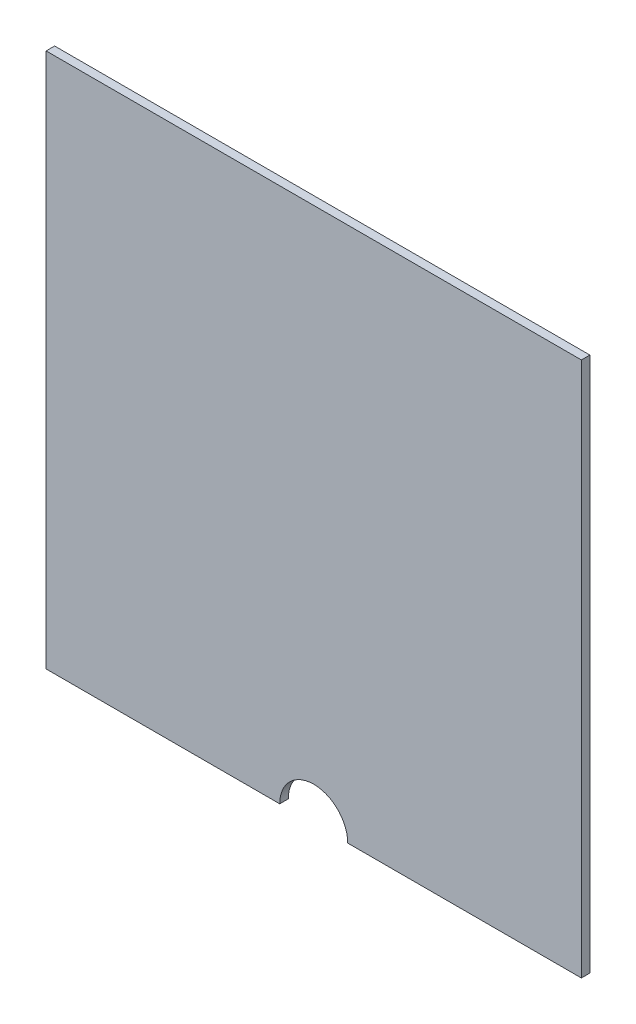
from build123d import *

# Parameters (mm, degrees)
SKETCH1_W           = 199.873
SKETCH1_H           = 199.873
BOSS_EXTRUDE1_DEPTH = 3.175
CUT_EXTRUDE3_DEPTH  = 3.175


with BuildPart() as part:
    # Sketch1 → Boss-Extrude1 (new body)
    with BuildSketch(Plane.XY):
        with Locations((99.9365, 99.9365)):
            Rectangle(SKETCH1_W, SKETCH1_H)
    extrude(amount=BOSS_EXTRUDE1_DEPTH)

    # Sketch3 → Cut-Extrude3 (cut)
    with BuildSketch(Plane.XY.offset(3.175)):
        with BuildLine():
            Line((87.2365, 0), (112.6365, 0))
            ThreePointArc((112.6365, 0), (99.9365, 12.7), (87.2365, 0))
        make_face()
    extrude(amount=-CUT_EXTRUDE3_DEPTH, mode=Mode.SUBTRACT)


solid = part.part
